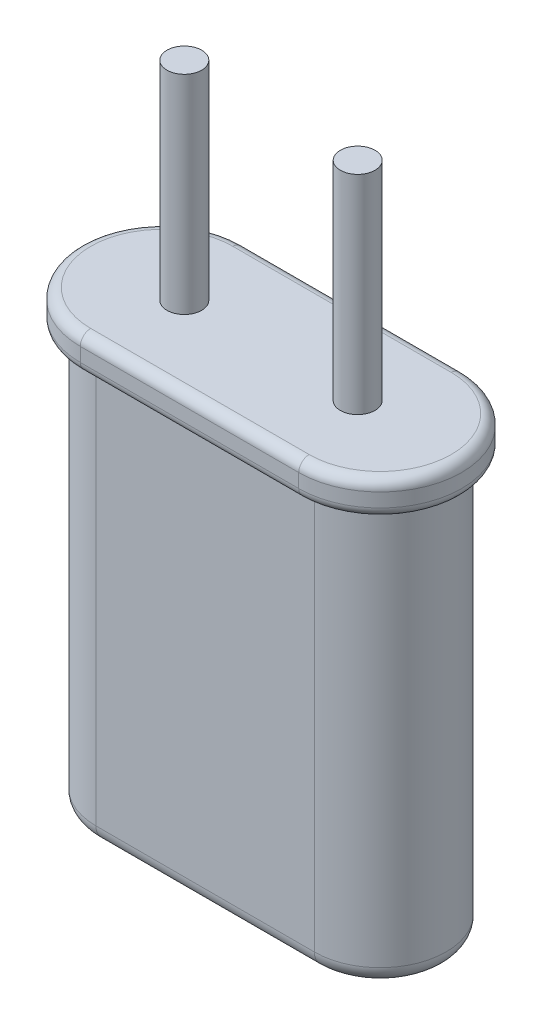
from build123d import *

# Parameters (mm, degrees)
EXTRUDE1_DEPTH = 1
EXTRUDE2_DEPTH = 12
FILLET1_R      = 0.3
FILLET2_R      = 0.5
SKETCH3_R      = 0.5
EXTRUDE3_DEPTH = 6


with BuildPart() as part:
    # Sketch1 → Extrude1 (new body)
    with BuildSketch(Plane(origin=(0, 0, 0), x_dir=(-1, 0, 0), z_dir=(0, 1, 0))):
        with BuildLine():
            Line((3.15, -2.35), (-3.15, -2.35))
            ThreePointArc((-3.15, -2.35), (-5.5, 0), (-3.15, 2.35))
            Line((-3.15, 2.35), (3.15, 2.35))
            ThreePointArc((3.15, 2.35), (5.5, 0), (3.15, -2.35))
        make_face()
    extrude(amount=-EXTRUDE1_DEPTH)

    # Sketch2 → Extrude2 (add)
    with BuildSketch(Plane.XZ.offset(1)):
        with BuildLine():
            Line((-3.15, -1.9), (3.15, -1.9))
            ThreePointArc((3.15, -1.9), (5.05, 0), (3.15, 1.9))
            Line((3.15, 1.9), (-3.15, 1.9))
            ThreePointArc((-3.15, 1.9), (-5.05, 0), (-3.15, -1.9))
        make_face()
    extrude(amount=EXTRUDE2_DEPTH)

    # Fillet1
    fillet1_edges = [part.edges().sort_by_distance(p)[0] for p in [
        (-5.5, 0, 0),
        (0, 0, 2.35),
        (5.5, 0, 0),
        (5.5, -1, 0),
        (-5.5, -1, 0),
        (0, -1, 2.35),
        (0, 0, -2.35),
        (0, -1, -2.35),
    ]]
    fillet(fillet1_edges, radius=FILLET1_R)

    # Fillet2
    fillet2_edges = [part.edges().sort_by_distance(p)[0] for p in [
        (0, -13, -1.9),
        (-5.05, -13, 0),
        (0, -13, 1.9),
        (5.05, -13, 0),
    ]]
    fillet(fillet2_edges, radius=FILLET2_R)

    # Sketch3 → Extrude3 (add)
    with BuildSketch(Plane(origin=(0, 0, 0), x_dir=(-1, 0, 0), z_dir=(0, 1, 0))):
        with Locations((2.5, 0)):
            Circle(SKETCH3_R)
        with Locations((-2.5, 0)):
            Circle(SKETCH3_R)
    extrude(amount=EXTRUDE3_DEPTH)


solid = part.part
